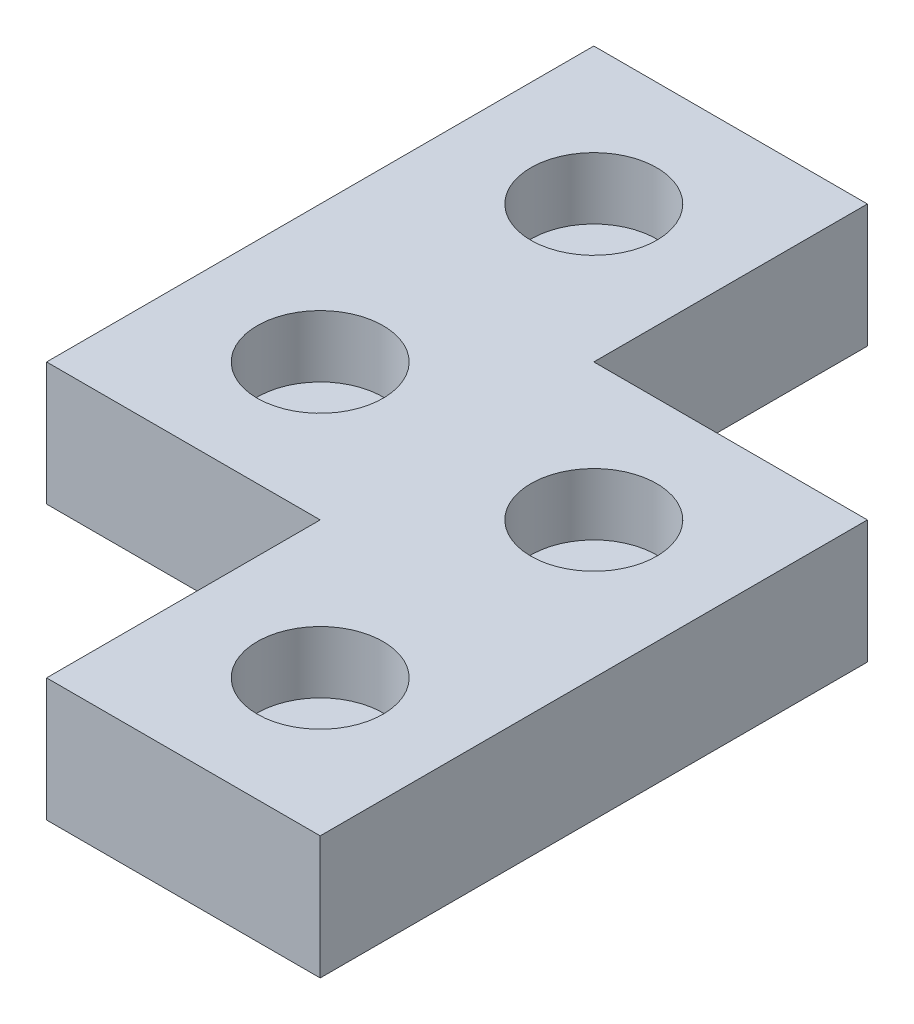
from build123d import *

# Parameters (mm, degrees)
BOSS_EXTRUDE2_DEPTH = 5.715
SKETCH2_R           = 2.921
CUT_EXTRUDE1_DEPTH  = 2.8702


with BuildPart() as part:
    # Sketch1 → Boss-Extrude2 (new body)
    with BuildSketch(Plane(origin=(0, 0, 0), x_dir=(1, 0, 0), z_dir=(0, 1, 0))):
        Polygon((-12.7, 15.59701387), (0, 15.59701387), (0, 2.89701387), (12.7, 2.89701387), (12.7, -22.50298613), (0, -22.50298613), (0, -9.80298613), (-12.7, -9.80298613), align=None)
    extrude(amount=BOSS_EXTRUDE2_DEPTH)

    # Sketch2 → Cut-Extrude1 (cut)
    with BuildSketch(Plane(origin=(0, 5.715, 0), x_dir=(1, 0, 0), z_dir=(0, 1, 0))):
        with Locations((-6.35, 9.24701387)):
            Circle(SKETCH2_R)
        with Locations((6.35, -16.15298613)):
            Circle(SKETCH2_R)
        with Locations((-6.35, -3.45298613)):
            Circle(SKETCH2_R)
        with Locations((6.35, -3.45298613)):
            Circle(SKETCH2_R)
    extrude(amount=-CUT_EXTRUDE1_DEPTH, mode=Mode.SUBTRACT)


solid = part.part
